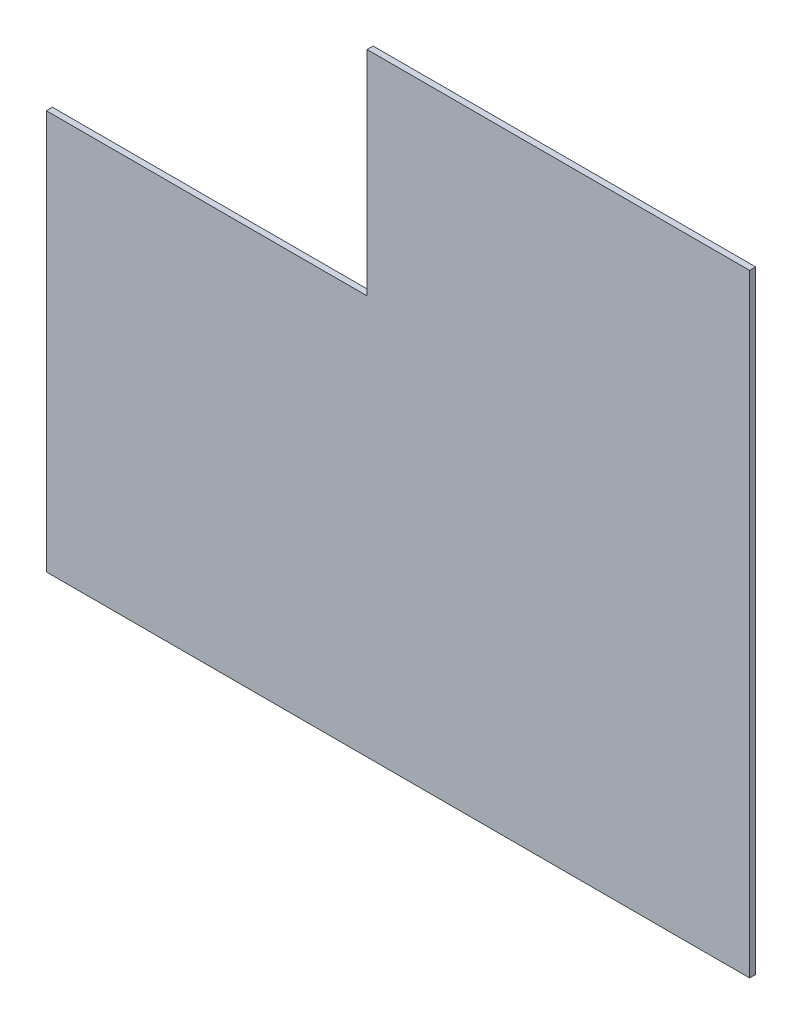
from build123d import *

# Parameters (mm, degrees)
EXTRUDE_1_DEPTH = 10


with BuildPart() as part:
    # Эскиз2 → Бобышка-Вытянуть1 (new body)
    with BuildSketch(Plane.XY):
        Polygon((1162.3, -506.285), (0, -506.285), (0, 153.715), (530, 153.715), (530, 506.285), (540, 506.285), (1162.3, 506.285), align=None)
    extrude(amount=-EXTRUDE_1_DEPTH)


solid = part.part
